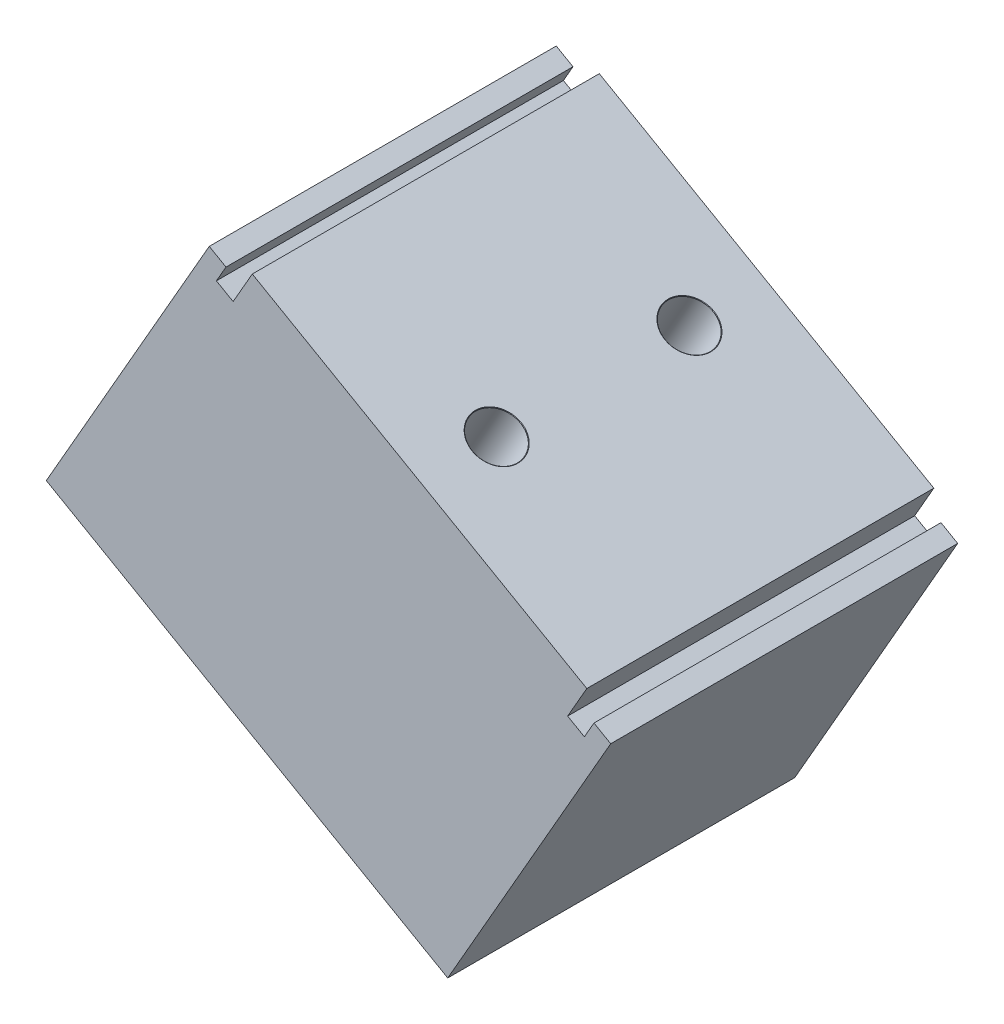
from build123d import *

# Parameters (mm, degrees)
EXTRUDE_START                = -9
EXTRUDE_1_DEPTH              = 18
SKETCH_5_R                   = 1
CUT_EXTRUDE_1_DEPTH          = 3
HOLE_WIZARD_M3_1_D           = 2.5
HOLE_WIZARD_M3_1_DEPTH       = 4
HOLE_WIZARD_M3_1_CSINK_D     = 2.55
HOLE_WIZARD_M3_1_CSINK_ANGLE = 90
HOLE_WIZARD_M3_1_TIP         = 0.751075774


# Read off the part's stored shape, not the designer's step: 凸台-拉伸1
with BuildPart() as part:
    # 凸台-拉伸1 outline → 凸台-拉伸1 (new body)
    with BuildSketch(Plane.XY.offset(EXTRUDE_START)):
        Polygon((67.226055932, -71.547534757), (68.220489275, -69.812281944), (50.867961141, -59.867948514), (49.873527798, -61.603201327), (49.005901391, -61.105984655), (49.503118063, -60.238358249), (48.635491656, -59.741141577), (40.18280824, -74.490790491), (61.005842001, -86.423990607), (69.458525416, -71.674341694), (68.59089901, -71.177125022), (68.093682338, -72.044751429), align=None)
    extrude(amount=EXTRUDE_1_DEPTH)

    # 草图5 → 切除-拉伸1 (cut)
    with BuildSketch(Plane(origin=(-13.251129944, -23.122777084, 0), x_dir=(0.8676264066772513, -0.49721667151888715, 0), z_dir=(0.49721667151888715, 0.8676264066772513, 0))):
        with Locations(Location((83.90172843, 5, 0), (0, 0, 180))):
            Circle(SKETCH_5_R)
        with Locations(Location((83.90172843, -5, 0), (0, 0, 180))):
            Circle(SKETCH_5_R)
    extrude(amount=-CUT_EXTRUDE_1_DEPTH, mode=Mode.SUBTRACT)

    # M3 螺纹孔的螺纹孔钻头1
    with Locations(Plane(origin=(-13.251129944, -23.122777084, 0), x_dir=(0.8676264066772513, -0.49721667151888715, 0), z_dir=(0.49721667151888715, 0.8676264066772513, 0))):
        with Locations((83.90172843, 5), (83.90172843, -5)):
            CounterSinkHole(HOLE_WIZARD_M3_1_D / 2, HOLE_WIZARD_M3_1_CSINK_D / 2, depth=HOLE_WIZARD_M3_1_DEPTH, counter_sink_angle=HOLE_WIZARD_M3_1_CSINK_ANGLE)
            with Locations((0, 0, -(HOLE_WIZARD_M3_1_DEPTH + HOLE_WIZARD_M3_1_TIP / 2))):  # 118° drill point
                Cone(0, HOLE_WIZARD_M3_1_D / 2, HOLE_WIZARD_M3_1_TIP, mode=Mode.SUBTRACT)


solid = part.part
